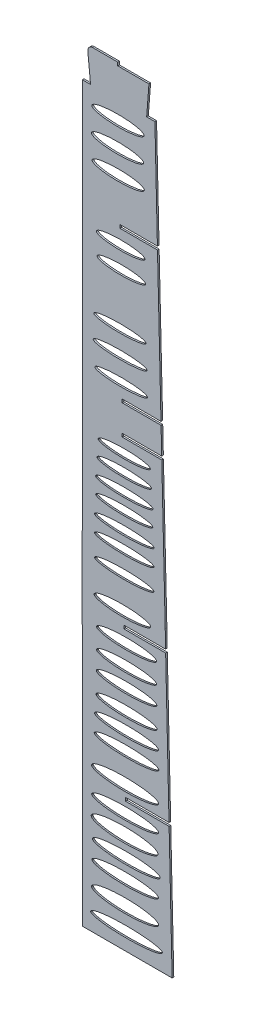
from build123d import *

# Parameters (mm, degrees)
MODEL_RX        = 15.986943764
MODEL_RY        = 2.545009851
MODEL_RX_2      = 16.38041862
MODEL_RX_3      = 15.816069984
MODEL_RX_4      = 14.731308039
MODEL_RY_2      = 2.868687023
MODEL_RX_5      = 15.836678469
MODEL_RY_3      = 3.31867263
EXTRUDE_1_DEPTH = 1


with BuildPart() as part:
    # Model → 凸台-拉伸1 (new body)
    with BuildSketch(Plane.XY):
        with BuildLine():
            Line((944.969286442, 755.114552128), (946.740517092, 678.696633773))
            Line((946.740517092, 678.696633773), (947.021045857, 667.114552128))
            Line((947.021045857, 667.114552128), (920.729970479, 667.114552128))
            Line((920.729970479, 667.114552128), (920.729970479, 665.114552128))
            Line((920.729970479, 665.114552128), (947.067643473, 665.114552128))
            Line((947.067643473, 665.114552128), (948.898027759, 586.364197286))
            Line((948.898027759, 586.364197286), (894.423978417, 586.364197286))
            Line((894.423978417, 586.364197286), (894.423978417, 679.687284047))
            Line((894.423978417, 679.687284047), (894.366320227, 767.566393999))
            Line((894.366320227, 767.566393999), (894.417704122, 858.913946195))
            Line((894.417704122, 858.913946195), (894.417704122, 921.017023249))
            Line((894.417704122, 921.017023249), (894.417704122, 981.017023249))
            Line((894.417704122, 981.017023249), (894.417704122, 1031.017023249))
            Line((894.417704122, 1031.017023249), (899.417704122, 1031.017023249))
            Line((899.417704122, 1031.017023249), (897.747555238, 1047.718512092))
            ThreePointArc((897.747555238, 1047.718512092), (898.508309208, 1050.030039212), (900.732666809, 1051.017023249))
            Line((900.732666809, 1051.017023249), (915.900304122, 1051.017023249))
            Line((915.900304122, 1051.017023249), (915.900304122, 1049.017023249))
            Line((915.900304122, 1049.017023249), (934.837206319, 1049.017023249))
            Line((934.837206319, 1049.017023249), (933.455089527, 1031.017023249))
            Line((933.455089527, 1031.017023249), (938.455089527, 1031.017023249))
            Line((938.455089527, 1031.017023249), (939.615876216, 981.017023249))
            Line((939.615876216, 981.017023249), (939.966332144, 966.352705315))
            Line((939.966332144, 966.352705315), (917.243104122, 966.352705315))
            Line((917.243104122, 966.352705315), (917.243104122, 964.352705315))
            Line((917.243104122, 964.352705315), (940.014130927, 964.352705315))
            Line((940.014130927, 964.352705315), (941.049790049, 921.017023249))
            Line((941.049790049, 921.017023249), (942.140767383, 875.366629343))
            Line((942.140767383, 875.366629343), (918.547704122, 875.366629343))
            Line((918.547704122, 875.366629343), (918.565369917, 873.366629343))
            Line((918.565369917, 873.366629343), (942.188564482, 873.366629343))
            Line((942.188564482, 873.366629343), (942.570941273, 857.364473382))
            Line((942.570941273, 857.364473382), (918.5053725, 857.364473382))
            Line((918.5053725, 857.364473382), (918.517024801, 855.364473382))
            Line((918.517024801, 855.364473382), (942.61634548, 855.364473382))
            Line((942.61634548, 855.364473382), (944.708162801, 767.739836438))
            Line((944.708162801, 767.739836438), (944.90633308, 757.114552128))
            Line((944.90633308, 757.114552128), (919.667487101, 757.114552128))
            Line((919.667487101, 757.114552128), (919.667487101, 755.114552128))
            Line((919.667487101, 755.114552128), (944.969286442, 755.114552128))
        make_face()
        with Locations((917.98787857, 883.919455094)):
            Ellipse(MODEL_RX, MODEL_RY, mode=Mode.SUBTRACT)
        with Locations((917.364059735, 897.974327105)):
            Ellipse(MODEL_RX_2, MODEL_RY, mode=Mode.SUBTRACT)
        with Locations((917.25658158, 911.816381375)):
            Ellipse(MODEL_RX_3, MODEL_RY, mode=Mode.SUBTRACT)
        with Locations((917.707328397, 955.706196734)):
            Ellipse(MODEL_RX_4, MODEL_RY_2, mode=Mode.SUBTRACT)
        with Locations((918.112294937, 942.872396856)):
            Ellipse(MODEL_RX_4, MODEL_RY_2, mode=Mode.SUBTRACT)
        with Locations((916.192845782, 991.771214575)):
            Ellipse(MODEL_RX_5, MODEL_RY_3, mode=Mode.SUBTRACT)
        with Locations((915.810165847, 1005.857350858)):
            Ellipse(MODEL_RX_5, MODEL_RY_3, mode=Mode.SUBTRACT)
        with Locations((916.045975981, 1020.364095818)):
            Ellipse(MODEL_RX_5, MODEL_RY_3, mode=Mode.SUBTRACT)
        Polygon((935.883085878, 764.326737174), (935.863085878, 764.166737174), (935.803085878, 764.006737174), (935.703085878, 763.848737174), (935.553085878, 763.690737174), (935.373085878, 763.533737174), (935.143085878, 763.379737174), (934.883085878, 763.227737174), (934.583085878, 763.077737174), (934.233085878, 762.931737174), (933.863085878, 762.788737174), (933.443085878, 762.648737174), (932.993085878, 762.513737174), (932.513085878, 762.382737174), (931.993085878, 762.256737174), (931.443085878, 762.135737174), (930.863085878, 762.019737174), (930.253085878, 761.908737174), (929.613085878, 761.803737174), (928.953085878, 761.705737174), (928.263085878, 761.613737174), (927.553085878, 761.527737174), (926.813085878, 761.448737174), (926.063085878, 761.376737174), (925.293085878, 761.311737174), (924.513085878, 761.253737174), (923.713085878, 761.203737174), (922.903085878, 761.160737174), (922.083085878, 761.125737174), (921.253085878, 761.098737174), (920.413085878, 761.078737174), (919.573085878, 761.067737174), (918.733085878, 761.063737174), (917.893085878, 761.067737174), (917.053085878, 761.078737174), (916.213085878, 761.098737174), (915.383085878, 761.125737174), (914.563085878, 761.160737174), (913.753085878, 761.203737174), (912.953085878, 761.253737174), (912.173085878, 761.311737174), (911.403085878, 761.376737174), (910.643085878, 761.448737174), (909.913085878, 761.527737174), (909.203085878, 761.613737174), (908.513085878, 761.705737174), (907.853085878, 761.803737174), (907.213085878, 761.908737174), (906.603085878, 762.019737174), (906.023085878, 762.135737174), (905.473085878, 762.256737174), (904.953085878, 762.382737174), (904.473085878, 762.513737174), (904.023085878, 762.648737174), (903.603085878, 762.788737174), (903.233085878, 762.931737174), (902.883085878, 763.077737174), (902.583085878, 763.227737174), (902.323085878, 763.379737174), (902.093085878, 763.533737174), (901.913085878, 763.690737174), (901.763085878, 763.848737174), (901.663085878, 764.006737174), (901.603085878, 764.166737174), (901.583085878, 764.326737174), (901.603085878, 764.487737174), (901.663085878, 764.646737174), (901.763085878, 764.805737174), (901.913085878, 764.963737174), (902.093085878, 765.119737174), (902.323085878, 765.274737174), (902.583085878, 765.426737174), (902.883085878, 765.575737174), (903.233085878, 765.722737174), (903.603085878, 765.865737174), (904.023085878, 766.004737174), (904.473085878, 766.140737174), (904.953085878, 766.271737174), (905.473085878, 766.397737174), (906.023085878, 766.518737174), (906.603085878, 766.634737174), (907.213085878, 766.745737174), (907.853085878, 766.849737174), (908.513085878, 766.948737174), (909.203085878, 767.040737174), (909.913085878, 767.126737174), (910.643085878, 767.205737174), (911.403085878, 767.277737174), (912.173085878, 767.342737174), (912.953085878, 767.399737174), (913.753085878, 767.450737174), (914.563085878, 767.492737174), (915.383085878, 767.527737174), (916.213085878, 767.555737174), (917.053085878, 767.574737174), (917.893085878, 767.586737174), (918.733085878, 767.590737174), (919.573085878, 767.586737174), (920.413085878, 767.574737174), (921.253085878, 767.555737174), (922.083085878, 767.527737174), (922.903085878, 767.492737174), (923.713085878, 767.450737174), (924.513085878, 767.399737174), (925.293085878, 767.342737174), (926.063085878, 767.277737174), (926.813085878, 767.205737174), (927.553085878, 767.126737174), (928.263085878, 767.040737174), (928.953085878, 766.948737174), (929.613085878, 766.849737174), (930.253085878, 766.745737174), (930.863085878, 766.634737174), (931.443085878, 766.518737174), (931.993085878, 766.397737174), (932.513085878, 766.271737174), (932.993085878, 766.140737174), (933.443085878, 766.004737174), (933.863085878, 765.865737174), (934.233085878, 765.722737174), (934.583085878, 765.575737174), (934.883085878, 765.426737174), (935.143085878, 765.274737174), (935.373085878, 765.119737174), (935.553085878, 764.963737174), (935.703085878, 764.805737174), (935.803085878, 764.646737174), (935.863085878, 764.487737174), align=None, mode=Mode.SUBTRACT)
        Polygon((939.473085878, 748.028737174), (939.453085878, 747.867737174), (939.383085878, 747.708737174), (939.273085878, 747.549737174), (939.123085878, 747.391737174), (938.933085878, 747.235737174), (938.693085878, 747.080737174), (938.413085878, 746.928737174), (938.083085878, 746.779737174), (937.723085878, 746.632737174), (937.323085878, 746.489737174), (936.883085878, 746.350737174), (936.403085878, 746.214737174), (935.893085878, 746.083737174), (935.343085878, 745.957737174), (934.753085878, 745.836737174), (934.143085878, 745.720737174), (933.493085878, 745.609737174), (932.813085878, 745.505737174), (932.113085878, 745.406737174), (931.383085878, 745.314737174), (930.623085878, 745.228737174), (929.853085878, 745.149737174), (929.053085878, 745.077737174), (928.233085878, 745.012737174), (927.403085878, 744.955737174), (926.553085878, 744.904737174), (925.693085878, 744.862737174), (924.823085878, 744.826737174), (923.943085878, 744.799737174), (923.053085878, 744.779737174), (922.163085878, 744.768737174), (921.263085878, 744.764737174), (920.373085878, 744.768737174), (919.483085878, 744.779737174), (918.593085878, 744.799737174), (917.713085878, 744.826737174), (916.843085878, 744.862737174), (915.983085878, 744.904737174), (915.133085878, 744.955737174), (914.303085878, 745.012737174), (913.483085878, 745.077737174), (912.683085878, 745.149737174), (911.903085878, 745.228737174), (911.153085878, 745.314737174), (910.423085878, 745.406737174), (909.713085878, 745.505737174), (909.043085878, 745.609737174), (908.393085878, 745.720737174), (907.773085878, 745.836737174), (907.193085878, 745.957737174), (906.643085878, 746.083737174), (906.133085878, 746.214737174), (905.653085878, 746.350737174), (905.213085878, 746.489737174), (904.813085878, 746.632737174), (904.443085878, 746.779737174), (904.123085878, 746.928737174), (903.843085878, 747.080737174), (903.603085878, 747.235737174), (903.413085878, 747.391737174), (903.263085878, 747.549737174), (903.153085878, 747.708737174), (903.083085878, 747.867737174), (903.063085878, 748.028737174), (903.083085878, 748.188737174), (903.153085878, 748.347737174), (903.263085878, 748.506737174), (903.413085878, 748.664737174), (903.603085878, 748.821737174), (903.843085878, 748.975737174), (904.123085878, 749.127737174), (904.443085878, 749.277737174), (904.813085878, 749.423737174), (905.213085878, 749.566737174), (905.653085878, 749.705737174), (906.133085878, 749.841737174), (906.643085878, 749.972737174), (907.193085878, 750.098737174), (907.773085878, 750.219737174), (908.393085878, 750.335737174), (909.043085878, 750.446737174), (909.713085878, 750.550737174), (910.423085878, 750.649737174), (911.153085878, 750.741737174), (911.903085878, 750.827737174), (912.683085878, 750.906737174), (913.483085878, 750.978737174), (914.303085878, 751.043737174), (915.133085878, 751.101737174), (915.983085878, 751.151737174), (916.843085878, 751.194737174), (917.713085878, 751.229737174), (918.593085878, 751.256737174), (919.483085878, 751.276737174), (920.373085878, 751.287737174), (921.263085878, 751.291737174), (922.163085878, 751.287737174), (923.053085878, 751.276737174), (923.943085878, 751.256737174), (924.823085878, 751.229737174), (925.693085878, 751.194737174), (926.553085878, 751.151737174), (927.403085878, 751.101737174), (928.233085878, 751.043737174), (929.053085878, 750.978737174), (929.853085878, 750.906737174), (930.623085878, 750.827737174), (931.383085878, 750.741737174), (932.113085878, 750.649737174), (932.813085878, 750.550737174), (933.493085878, 750.446737174), (934.143085878, 750.335737174), (934.753085878, 750.219737174), (935.343085878, 750.098737174), (935.893085878, 749.972737174), (936.403085878, 749.841737174), (936.883085878, 749.705737174), (937.323085878, 749.566737174), (937.723085878, 749.423737174), (938.083085878, 749.277737174), (938.413085878, 749.127737174), (938.693085878, 748.975737174), (938.933085878, 748.821737174), (939.123085878, 748.664737174), (939.273085878, 748.506737174), (939.383085878, 748.347737174), (939.453085878, 748.188737174), align=None, mode=Mode.SUBTRACT)
        Polygon((939.473085878, 735.969737174), (939.453085878, 735.809737174), (939.383085878, 735.649737174), (939.273085878, 735.491737174), (939.123085878, 735.333737174), (938.933085878, 735.176737174), (938.693085878, 735.022737174), (938.413085878, 734.870737174), (938.083085878, 734.720737174), (937.723085878, 734.574737174), (937.323085878, 734.431737174), (936.883085878, 734.291737174), (936.403085878, 734.156737174), (935.893085878, 734.025737174), (935.343085878, 733.899737174), (934.753085878, 733.778737174), (934.143085878, 733.662737174), (933.493085878, 733.551737174), (932.813085878, 733.446737174), (932.113085878, 733.348737174), (931.383085878, 733.256737174), (930.623085878, 733.170737174), (929.853085878, 733.091737174), (929.053085878, 733.019737174), (928.233085878, 732.954737174), (927.403085878, 732.896737174), (926.553085878, 732.846737174), (925.693085878, 732.803737174), (924.823085878, 732.768737174), (923.943085878, 732.741737174), (923.053085878, 732.721737174), (922.163085878, 732.710737174), (921.263085878, 732.706737174), (920.373085878, 732.710737174), (919.483085878, 732.721737174), (918.593085878, 732.741737174), (917.713085878, 732.768737174), (916.843085878, 732.803737174), (915.983085878, 732.846737174), (915.133085878, 732.896737174), (914.303085878, 732.954737174), (913.483085878, 733.019737174), (912.683085878, 733.091737174), (911.903085878, 733.170737174), (911.153085878, 733.256737174), (910.423085878, 733.348737174), (909.713085878, 733.446737174), (909.043085878, 733.551737174), (908.393085878, 733.662737174), (907.773085878, 733.778737174), (907.193085878, 733.899737174), (906.643085878, 734.025737174), (906.133085878, 734.156737174), (905.653085878, 734.291737174), (905.213085878, 734.431737174), (904.813085878, 734.574737174), (904.443085878, 734.720737174), (904.123085878, 734.870737174), (903.843085878, 735.022737174), (903.603085878, 735.176737174), (903.413085878, 735.333737174), (903.263085878, 735.491737174), (903.153085878, 735.649737174), (903.083085878, 735.809737174), (903.063085878, 735.969737174), (903.083085878, 736.130737174), (903.153085878, 736.289737174), (903.263085878, 736.448737174), (903.413085878, 736.606737174), (903.603085878, 736.762737174), (903.843085878, 736.917737174), (904.123085878, 737.069737174), (904.443085878, 737.218737174), (904.813085878, 737.365737174), (905.213085878, 737.508737174), (905.653085878, 737.647737174), (906.133085878, 737.783737174), (906.643085878, 737.914737174), (907.193085878, 738.040737174), (907.773085878, 738.161737174), (908.393085878, 738.277737174), (909.043085878, 738.388737174), (909.713085878, 738.492737174), (910.423085878, 738.591737174), (911.153085878, 738.683737174), (911.903085878, 738.769737174), (912.683085878, 738.848737174), (913.483085878, 738.920737174), (914.303085878, 738.985737174), (915.133085878, 739.042737174), (915.983085878, 739.093737174), (916.843085878, 739.135737174), (917.713085878, 739.170737174), (918.593085878, 739.198737174), (919.483085878, 739.217737174), (920.373085878, 739.229737174), (921.263085878, 739.233737174), (922.163085878, 739.229737174), (923.053085878, 739.217737174), (923.943085878, 739.198737174), (924.823085878, 739.170737174), (925.693085878, 739.135737174), (926.553085878, 739.093737174), (927.403085878, 739.042737174), (928.233085878, 738.985737174), (929.053085878, 738.920737174), (929.853085878, 738.848737174), (930.623085878, 738.769737174), (931.383085878, 738.683737174), (932.113085878, 738.591737174), (932.813085878, 738.492737174), (933.493085878, 738.388737174), (934.143085878, 738.277737174), (934.753085878, 738.161737174), (935.343085878, 738.040737174), (935.893085878, 737.914737174), (936.403085878, 737.783737174), (936.883085878, 737.647737174), (937.323085878, 737.508737174), (937.723085878, 737.365737174), (938.083085878, 737.218737174), (938.413085878, 737.069737174), (938.693085878, 736.917737174), (938.933085878, 736.762737174), (939.123085878, 736.606737174), (939.273085878, 736.448737174), (939.383085878, 736.289737174), (939.453085878, 736.130737174), align=None, mode=Mode.SUBTRACT)
        Polygon((939.643085878, 724.934737174), (939.623085878, 724.773737174), (939.553085878, 724.614737174), (939.443085878, 724.455737174), (939.283085878, 724.297737174), (939.093085878, 724.141737174), (938.853085878, 723.986737174), (938.563085878, 723.834737174), (938.243085878, 723.685737174), (937.873085878, 723.538737174), (937.473085878, 723.395737174), (937.023085878, 723.256737174), (936.543085878, 723.120737174), (936.023085878, 722.989737174), (935.473085878, 722.863737174), (934.883085878, 722.742737174), (934.263085878, 722.626737174), (933.603085878, 722.515737174), (932.923085878, 722.411737174), (932.213085878, 722.312737174), (931.473085878, 722.220737174), (930.713085878, 722.134737174), (929.933085878, 722.055737174), (929.123085878, 721.983737174), (928.303085878, 721.918737174), (927.453085878, 721.861737174), (926.603085878, 721.810737174), (925.733085878, 721.768737174), (924.853085878, 721.733737174), (923.963085878, 721.705737174), (923.073085878, 721.686737174), (922.173085878, 721.674737174), (921.263085878, 721.670737174), (920.363085878, 721.674737174), (919.463085878, 721.686737174), (918.573085878, 721.705737174), (917.683085878, 721.733737174), (916.803085878, 721.768737174), (915.933085878, 721.810737174), (915.073085878, 721.861737174), (914.233085878, 721.918737174), (913.413085878, 721.983737174), (912.603085878, 722.055737174), (911.823085878, 722.134737174), (911.063085878, 722.220737174), (910.323085878, 722.312737174), (909.613085878, 722.411737174), (908.933085878, 722.515737174), (908.273085878, 722.626737174), (907.653085878, 722.742737174), (907.063085878, 722.863737174), (906.513085878, 722.989737174), (905.993085878, 723.120737174), (905.513085878, 723.256737174), (905.063085878, 723.395737174), (904.663085878, 723.538737174), (904.293085878, 723.685737174), (903.973085878, 723.834737174), (903.683085878, 723.986737174), (903.443085878, 724.141737174), (903.243085878, 724.297737174), (903.093085878, 724.455737174), (902.983085878, 724.614737174), (902.913085878, 724.773737174), (902.893085878, 724.934737174), (902.913085878, 725.094737174), (902.983085878, 725.253737174), (903.093085878, 725.412737174), (903.243085878, 725.570737174), (903.443085878, 725.727737174), (903.683085878, 725.881737174), (903.973085878, 726.033737174), (904.293085878, 726.183737174), (904.663085878, 726.329737174), (905.063085878, 726.472737174), (905.513085878, 726.611737174), (905.993085878, 726.747737174), (906.513085878, 726.878737174), (907.063085878, 727.004737174), (907.653085878, 727.125737174), (908.273085878, 727.241737174), (908.933085878, 727.352737174), (909.613085878, 727.456737174), (910.323085878, 727.555737174), (911.063085878, 727.647737174), (911.823085878, 727.733737174), (912.603085878, 727.812737174), (913.413085878, 727.884737174), (914.233085878, 727.949737174), (915.073085878, 728.007737174), (915.933085878, 728.057737174), (916.803085878, 728.100737174), (917.683085878, 728.135737174), (918.573085878, 728.162737174), (919.463085878, 728.182737174), (920.363085878, 728.193737174), (921.263085878, 728.197737174), (922.173085878, 728.193737174), (923.073085878, 728.182737174), (923.963085878, 728.162737174), (924.853085878, 728.135737174), (925.733085878, 728.100737174), (926.603085878, 728.057737174), (927.453085878, 728.007737174), (928.303085878, 727.949737174), (929.123085878, 727.884737174), (929.933085878, 727.812737174), (930.713085878, 727.733737174), (931.473085878, 727.647737174), (932.213085878, 727.555737174), (932.923085878, 727.456737174), (933.603085878, 727.352737174), (934.263085878, 727.241737174), (934.883085878, 727.125737174), (935.473085878, 727.004737174), (936.023085878, 726.878737174), (936.543085878, 726.747737174), (937.023085878, 726.611737174), (937.473085878, 726.472737174), (937.873085878, 726.329737174), (938.243085878, 726.183737174), (938.563085878, 726.033737174), (938.853085878, 725.881737174), (939.093085878, 725.727737174), (939.283085878, 725.570737174), (939.443085878, 725.412737174), (939.553085878, 725.253737174), (939.623085878, 725.094737174), align=None, mode=Mode.SUBTRACT)
        Polygon((939.803085878, 712.395737174), (939.783085878, 712.235737174), (939.723085878, 712.075737174), (939.603085878, 711.916737174), (939.453085878, 711.758737174), (939.253085878, 711.602737174), (939.013085878, 711.448737174), (938.723085878, 711.295737174), (938.393085878, 711.146737174), (938.023085878, 711.000737174), (937.623085878, 710.856737174), (937.173085878, 710.717737174), (936.683085878, 710.582737174), (936.163085878, 710.451737174), (935.603085878, 710.325737174), (935.003085878, 710.203737174), (934.373085878, 710.087737174), (933.723085878, 709.977737174), (933.033085878, 709.872737174), (932.313085878, 709.774737174), (931.563085878, 709.681737174), (930.803085878, 709.596737174), (930.003085878, 709.517737174), (929.193085878, 709.445737174), (928.363085878, 709.380737174), (927.513085878, 709.322737174), (926.653085878, 709.272737174), (925.773085878, 709.229737174), (924.883085878, 709.194737174), (923.983085878, 709.167737174), (923.083085878, 709.147737174), (922.173085878, 709.135737174), (921.263085878, 709.131737174), (920.353085878, 709.135737174), (919.453085878, 709.147737174), (918.543085878, 709.167737174), (917.653085878, 709.194737174), (916.763085878, 709.229737174), (915.883085878, 709.272737174), (915.023085878, 709.322737174), (914.173085878, 709.380737174), (913.343085878, 709.445737174), (912.523085878, 709.517737174), (911.733085878, 709.596737174), (910.963085878, 709.681737174), (910.223085878, 709.774737174), (909.503085878, 709.872737174), (908.813085878, 709.977737174), (908.153085878, 710.087737174), (907.533085878, 710.203737174), (906.933085878, 710.325737174), (906.373085878, 710.451737174), (905.853085878, 710.582737174), (905.363085878, 710.717737174), (904.913085878, 710.856737174), (904.503085878, 711.000737174), (904.143085878, 711.146737174), (903.813085878, 711.295737174), (903.523085878, 711.448737174), (903.283085878, 711.602737174), (903.083085878, 711.758737174), (902.933085878, 711.916737174), (902.813085878, 712.075737174), (902.753085878, 712.235737174), (902.723085878, 712.395737174), (902.753085878, 712.555737174), (902.813085878, 712.715737174), (902.933085878, 712.874737174), (903.083085878, 713.032737174), (903.283085878, 713.188737174), (903.523085878, 713.342737174), (903.813085878, 713.495737174), (904.143085878, 713.644737174), (904.503085878, 713.790737174), (904.913085878, 713.934737174), (905.363085878, 714.073737174), (905.853085878, 714.208737174), (906.373085878, 714.339737174), (906.933085878, 714.466737174), (907.533085878, 714.587737174), (908.153085878, 714.703737174), (908.813085878, 714.813737174), (909.503085878, 714.918737174), (910.223085878, 715.017737174), (910.963085878, 715.109737174), (911.733085878, 715.194737174), (912.523085878, 715.273737174), (913.343085878, 715.345737174), (914.173085878, 715.410737174), (915.023085878, 715.468737174), (915.883085878, 715.518737174), (916.763085878, 715.561737174), (917.653085878, 715.596737174), (918.543085878, 715.623737174), (919.453085878, 715.643737174), (920.353085878, 715.655737174), (921.263085878, 715.659737174), (922.173085878, 715.655737174), (923.083085878, 715.643737174), (923.983085878, 715.623737174), (924.883085878, 715.596737174), (925.773085878, 715.561737174), (926.653085878, 715.518737174), (927.513085878, 715.468737174), (928.363085878, 715.410737174), (929.193085878, 715.345737174), (930.003085878, 715.273737174), (930.803085878, 715.194737174), (931.563085878, 715.109737174), (932.313085878, 715.017737174), (933.033085878, 714.918737174), (933.723085878, 714.813737174), (934.373085878, 714.703737174), (935.003085878, 714.587737174), (935.603085878, 714.466737174), (936.163085878, 714.339737174), (936.683085878, 714.208737174), (937.173085878, 714.073737174), (937.623085878, 713.934737174), (938.023085878, 713.790737174), (938.393085878, 713.644737174), (938.723085878, 713.495737174), (939.013085878, 713.342737174), (939.253085878, 713.188737174), (939.453085878, 713.032737174), (939.603085878, 712.874737174), (939.723085878, 712.715737174), (939.783085878, 712.555737174), align=None, mode=Mode.SUBTRACT)
        Polygon((940.703085878, 702.070737174), (940.673085878, 701.910737174), (940.603085878, 701.751737174), (940.483085878, 701.592737174), (940.323085878, 701.434737174), (940.113085878, 701.277737174), (939.863085878, 701.123737174), (939.563085878, 700.971737174), (939.223085878, 700.821737174), (938.833085878, 700.675737174), (938.403085878, 700.532737174), (937.933085878, 700.393737174), (937.423085878, 700.257737174), (936.873085878, 700.126737174), (936.283085878, 700.000737174), (935.663085878, 699.879737174), (935.003085878, 699.763737174), (934.313085878, 699.652737174), (933.593085878, 699.548737174), (932.843085878, 699.449737174), (932.063085878, 699.357737174), (931.253085878, 699.271737174), (930.423085878, 699.192737174), (929.573085878, 699.120737174), (928.703085878, 699.055737174), (927.813085878, 698.997737174), (926.903085878, 698.947737174), (925.993085878, 698.905737174), (925.063085878, 698.869737174), (924.123085878, 698.842737174), (923.173085878, 698.822737174), (922.223085878, 698.811737174), (921.263085878, 698.807737174), (920.313085878, 698.811737174), (919.363085878, 698.822737174), (918.413085878, 698.842737174), (917.473085878, 698.869737174), (916.543085878, 698.905737174), (915.623085878, 698.947737174), (914.723085878, 698.997737174), (913.833085878, 699.055737174), (912.963085878, 699.120737174), (912.113085878, 699.192737174), (911.283085878, 699.271737174), (910.473085878, 699.357737174), (909.693085878, 699.449737174), (908.943085878, 699.548737174), (908.223085878, 699.652737174), (907.533085878, 699.763737174), (906.873085878, 699.879737174), (906.243085878, 700.000737174), (905.663085878, 700.126737174), (905.113085878, 700.257737174), (904.603085878, 700.393737174), (904.133085878, 700.532737174), (903.703085878, 700.675737174), (903.313085878, 700.821737174), (902.973085878, 700.971737174), (902.673085878, 701.123737174), (902.423085878, 701.277737174), (902.213085878, 701.434737174), (902.043085878, 701.592737174), (901.933085878, 701.751737174), (901.863085878, 701.910737174), (901.833085878, 702.070737174), (901.863085878, 702.231737174), (901.933085878, 702.390737174), (902.043085878, 702.549737174), (902.213085878, 702.707737174), (902.423085878, 702.863737174), (902.673085878, 703.018737174), (902.973085878, 703.170737174), (903.313085878, 703.319737174), (903.703085878, 703.466737174), (904.133085878, 703.609737174), (904.603085878, 703.748737174), (905.113085878, 703.884737174), (905.663085878, 704.015737174), (906.243085878, 704.141737174), (906.873085878, 704.262737174), (907.533085878, 704.378737174), (908.223085878, 704.489737174), (908.943085878, 704.593737174), (909.693085878, 704.692737174), (910.473085878, 704.784737174), (911.283085878, 704.870737174), (912.113085878, 704.949737174), (912.963085878, 705.021737174), (913.833085878, 705.086737174), (914.723085878, 705.143737174), (915.623085878, 705.194737174), (916.543085878, 705.236737174), (917.473085878, 705.272737174), (918.413085878, 705.299737174), (919.363085878, 705.319737174), (920.313085878, 705.330737174), (921.263085878, 705.334737174), (922.223085878, 705.330737174), (923.173085878, 705.319737174), (924.123085878, 705.299737174), (925.063085878, 705.272737174), (925.993085878, 705.236737174), (926.903085878, 705.194737174), (927.813085878, 705.143737174), (928.703085878, 705.086737174), (929.573085878, 705.021737174), (930.423085878, 704.949737174), (931.253085878, 704.870737174), (932.063085878, 704.784737174), (932.843085878, 704.692737174), (933.593085878, 704.593737174), (934.313085878, 704.489737174), (935.003085878, 704.378737174), (935.663085878, 704.262737174), (936.283085878, 704.141737174), (936.873085878, 704.015737174), (937.423085878, 703.884737174), (937.933085878, 703.748737174), (938.403085878, 703.609737174), (938.833085878, 703.466737174), (939.223085878, 703.319737174), (939.563085878, 703.170737174), (939.863085878, 703.018737174), (940.113085878, 702.863737174), (940.323085878, 702.707737174), (940.483085878, 702.549737174), (940.603085878, 702.390737174), (940.673085878, 702.231737174), align=None, mode=Mode.SUBTRACT)
        Polygon((940.893085878, 691.530737174), (940.873085878, 691.370737174), (940.803085878, 691.210737174), (940.683085878, 691.051737174), (940.523085878, 690.894737174), (940.313085878, 690.737737174), (940.053085878, 690.583737174), (939.753085878, 690.431737174), (939.403085878, 690.281737174), (939.013085878, 690.135737174), (938.583085878, 689.992737174), (938.103085878, 689.852737174), (937.593085878, 689.717737174), (937.033085878, 689.586737174), (936.443085878, 689.460737174), (935.813085878, 689.339737174), (935.143085878, 689.223737174), (934.453085878, 689.112737174), (933.723085878, 689.007737174), (932.963085878, 688.909737174), (932.173085878, 688.817737174), (931.363085878, 688.731737174), (930.523085878, 688.652737174), (929.663085878, 688.580737174), (928.783085878, 688.515737174), (927.883085878, 688.457737174), (926.963085878, 688.407737174), (926.033085878, 688.364737174), (925.093085878, 688.329737174), (924.143085878, 688.302737174), (923.193085878, 688.282737174), (922.233085878, 688.271737174), (921.263085878, 688.267737174), (920.303085878, 688.271737174), (919.343085878, 688.282737174), (918.383085878, 688.302737174), (917.443085878, 688.329737174), (916.503085878, 688.364737174), (915.573085878, 688.407737174), (914.653085878, 688.457737174), (913.753085878, 688.515737174), (912.873085878, 688.580737174), (912.013085878, 688.652737174), (911.173085878, 688.731737174), (910.363085878, 688.817737174), (909.573085878, 688.909737174), (908.813085878, 689.007737174), (908.083085878, 689.112737174), (907.383085878, 689.223737174), (906.723085878, 689.339737174), (906.093085878, 689.460737174), (905.503085878, 689.586737174), (904.943085878, 689.717737174), (904.433085878, 689.852737174), (903.953085878, 689.992737174), (903.523085878, 690.135737174), (903.133085878, 690.281737174), (902.783085878, 690.431737174), (902.483085878, 690.583737174), (902.223085878, 690.737737174), (902.013085878, 690.894737174), (901.853085878, 691.051737174), (901.733085878, 691.210737174), (901.663085878, 691.370737174), (901.643085878, 691.530737174), (901.663085878, 691.690737174), (901.733085878, 691.850737174), (901.853085878, 692.009737174), (902.013085878, 692.167737174), (902.223085878, 692.323737174), (902.483085878, 692.478737174), (902.783085878, 692.630737174), (903.133085878, 692.779737174), (903.523085878, 692.926737174), (903.953085878, 693.069737174), (904.433085878, 693.208737174), (904.943085878, 693.344737174), (905.503085878, 693.475737174), (906.093085878, 693.601737174), (906.723085878, 693.722737174), (907.383085878, 693.838737174), (908.083085878, 693.949737174), (908.813085878, 694.053737174), (909.573085878, 694.152737174), (910.363085878, 694.244737174), (911.173085878, 694.330737174), (912.013085878, 694.409737174), (912.873085878, 694.481737174), (913.753085878, 694.546737174), (914.653085878, 694.603737174), (915.573085878, 694.654737174), (916.503085878, 694.696737174), (917.443085878, 694.731737174), (918.383085878, 694.759737174), (919.343085878, 694.778737174), (920.303085878, 694.790737174), (921.263085878, 694.794737174), (922.233085878, 694.790737174), (923.193085878, 694.778737174), (924.143085878, 694.759737174), (925.093085878, 694.731737174), (926.033085878, 694.696737174), (926.963085878, 694.654737174), (927.883085878, 694.603737174), (928.783085878, 694.546737174), (929.663085878, 694.481737174), (930.523085878, 694.409737174), (931.363085878, 694.330737174), (932.173085878, 694.244737174), (932.963085878, 694.152737174), (933.723085878, 694.053737174), (934.453085878, 693.949737174), (935.143085878, 693.838737174), (935.813085878, 693.722737174), (936.443085878, 693.601737174), (937.033085878, 693.475737174), (937.593085878, 693.344737174), (938.103085878, 693.208737174), (938.583085878, 693.069737174), (939.013085878, 692.926737174), (939.403085878, 692.779737174), (939.753085878, 692.630737174), (940.053085878, 692.478737174), (940.313085878, 692.323737174), (940.523085878, 692.167737174), (940.683085878, 692.009737174), (940.803085878, 691.850737174), (940.873085878, 691.690737174), align=None, mode=Mode.SUBTRACT)
        Polygon((900.011309371, 673.832528614), (900.031309371, 674.019528614), (900.111309371, 674.205528614), (900.231309371, 674.391528614), (900.401309371, 674.575528614), (900.621309371, 674.758528614), (900.891309371, 674.938528614), (901.201309371, 675.116528614), (901.561309371, 675.291528614), (901.961309371, 675.462528614), (902.411309371, 675.629528614), (902.901309371, 675.792528614), (903.441309371, 675.950528614), (904.011309371, 676.103528614), (904.631309371, 676.250528614), (905.281309371, 676.392528614), (905.971309371, 676.528528614), (906.691309371, 676.657528614), (907.451309371, 676.779528614), (908.241309371, 676.894528614), (909.051309371, 677.002528614), (909.901309371, 677.102528614), (910.771309371, 677.194528614), (911.661309371, 677.278528614), (912.571309371, 677.354528614), (913.501309371, 677.421528614), (914.451309371, 677.480528614), (915.411309371, 677.530528614), (916.391309371, 677.571528614), (917.371309371, 677.603528614), (918.361309371, 677.626528614), (919.361309371, 677.640528614), (920.361309371, 677.644528614), (921.361309371, 677.640528614), (922.351309371, 677.626528614), (923.341309371, 677.603528614), (924.331309371, 677.571528614), (925.301309371, 677.530528614), (926.271309371, 677.480528614), (927.211309371, 677.421528614), (928.151309371, 677.354528614), (929.061309371, 677.278528614), (929.951309371, 677.194528614), (930.821309371, 677.102528614), (931.661309371, 677.002528614), (932.481309371, 676.894528614), (933.271309371, 676.779528614), (934.021309371, 676.657528614), (934.751309371, 676.528528614), (935.441309371, 676.392528614), (936.091309371, 676.250528614), (936.701309371, 676.103528614), (937.281309371, 675.950528614), (937.811309371, 675.792528614), (938.301309371, 675.629528614), (938.751309371, 675.462528614), (939.161309371, 675.291528614), (939.521309371, 675.116528614), (939.831309371, 674.938528614), (940.101309371, 674.758528614), (940.321309371, 674.575528614), (940.491309371, 674.391528614), (940.611309371, 674.205528614), (940.681309371, 674.019528614), (940.711309371, 673.832528614), (940.681309371, 673.645528614), (940.611309371, 673.458528614), (940.491309371, 673.272528614), (940.321309371, 673.088528614), (940.101309371, 672.905528614), (939.831309371, 672.725528614), (939.521309371, 672.547528614), (939.161309371, 672.373528614), (938.751309371, 672.201528614), (938.301309371, 672.034528614), (937.811309371, 671.872528614), (937.281309371, 671.713528614), (936.701309371, 671.560528614), (936.091309371, 671.413528614), (935.441309371, 671.271528614), (934.751309371, 671.136528614), (934.021309371, 671.007528614), (933.271309371, 670.884528614), (932.481309371, 670.769528614), (931.661309371, 670.662528614), (930.821309371, 670.561528614), (929.951309371, 670.469528614), (929.061309371, 670.385528614), (928.151309371, 670.309528614), (927.211309371, 670.242528614), (926.271309371, 670.183528614), (925.301309371, 670.133528614), (924.331309371, 670.092528614), (923.341309371, 670.060528614), (922.351309371, 670.037528614), (921.361309371, 670.024528614), (920.361309371, 670.019528614), (919.361309371, 670.024528614), (918.361309371, 670.037528614), (917.371309371, 670.060528614), (916.391309371, 670.092528614), (915.411309371, 670.133528614), (914.451309371, 670.183528614), (913.501309371, 670.242528614), (912.571309371, 670.309528614), (911.661309371, 670.385528614), (910.771309371, 670.469528614), (909.901309371, 670.561528614), (909.051309371, 670.662528614), (908.241309371, 670.769528614), (907.451309371, 670.884528614), (906.691309371, 671.007528614), (905.971309371, 671.136528614), (905.281309371, 671.271528614), (904.631309371, 671.413528614), (904.011309371, 671.560528614), (903.441309371, 671.713528614), (902.901309371, 671.872528614), (902.411309371, 672.034528614), (901.961309371, 672.201528614), (901.561309371, 672.373528614), (901.201309371, 672.547528614), (900.891309371, 672.725528614), (900.621309371, 672.905528614), (900.401309371, 673.088528614), (900.231309371, 673.272528614), (900.111309371, 673.458528614), (900.031309371, 673.645528614), align=None, mode=Mode.SUBTRACT)
        Polygon((900.111309371, 658.612528614), (900.141309371, 658.789528614), (900.211309371, 658.965528614), (900.331309371, 659.141528614), (900.501309371, 659.315528614), (900.721309371, 659.487528614), (900.991309371, 659.658528614), (901.301309371, 659.826528614), (901.661309371, 659.991528614), (902.061309371, 660.153528614), (902.511309371, 660.311528614), (903.001309371, 660.465528614), (903.531309371, 660.614528614), (904.111309371, 660.759528614), (904.721309371, 660.898528614), (905.371309371, 661.032528614), (906.061309371, 661.160528614), (906.781309371, 661.282528614), (907.531309371, 661.398528614), (908.321309371, 661.506528614), (909.131309371, 661.608528614), (909.971309371, 661.703528614), (910.841309371, 661.790528614), (911.731309371, 661.870528614), (912.641309371, 661.941528614), (913.571309371, 662.005528614), (914.521309371, 662.060528614), (915.481309371, 662.108528614), (916.451309371, 662.146528614), (917.431309371, 662.177528614), (918.421309371, 662.198528614), (919.411309371, 662.211528614), (920.411309371, 662.216528614), (921.411309371, 662.211528614), (922.401309371, 662.198528614), (923.391309371, 662.177528614), (924.371309371, 662.146528614), (925.341309371, 662.108528614), (926.301309371, 662.060528614), (927.251309371, 662.005528614), (928.181309371, 661.941528614), (929.091309371, 661.870528614), (929.981309371, 661.790528614), (930.841309371, 661.703528614), (931.691309371, 661.608528614), (932.501309371, 661.506528614), (933.291309371, 661.398528614), (934.041309371, 661.282528614), (934.761309371, 661.160528614), (935.451309371, 661.032528614), (936.101309371, 660.898528614), (936.711309371, 660.759528614), (937.291309371, 660.614528614), (937.821309371, 660.465528614), (938.311309371, 660.311528614), (938.761309371, 660.153528614), (939.161309371, 659.991528614), (939.521309371, 659.826528614), (939.831309371, 659.658528614), (940.101309371, 659.487528614), (940.321309371, 659.315528614), (940.491309371, 659.141528614), (940.611309371, 658.965528614), (940.681309371, 658.789528614), (940.711309371, 658.612528614), (940.681309371, 658.435528614), (940.611309371, 658.259528614), (940.491309371, 658.083528614), (940.321309371, 657.909528614), (940.101309371, 657.736528614), (939.831309371, 657.566528614), (939.521309371, 657.398528614), (939.161309371, 657.233528614), (938.761309371, 657.071528614), (938.311309371, 656.913528614), (937.821309371, 656.759528614), (937.291309371, 656.610528614), (936.711309371, 656.465528614), (936.101309371, 656.326528614), (935.451309371, 656.192528614), (934.761309371, 656.064528614), (934.041309371, 655.942528614), (933.291309371, 655.826528614), (932.501309371, 655.717528614), (931.691309371, 655.615528614), (930.841309371, 655.521528614), (929.981309371, 655.434528614), (929.091309371, 655.354528614), (928.181309371, 655.282528614), (927.251309371, 655.219528614), (926.301309371, 655.163528614), (925.341309371, 655.116528614), (924.371309371, 655.077528614), (923.391309371, 655.047528614), (922.401309371, 655.025528614), (921.411309371, 655.012528614), (920.411309371, 655.008528614), (919.411309371, 655.012528614), (918.421309371, 655.025528614), (917.431309371, 655.047528614), (916.451309371, 655.077528614), (915.481309371, 655.116528614), (914.521309371, 655.163528614), (913.571309371, 655.219528614), (912.641309371, 655.282528614), (911.731309371, 655.354528614), (910.841309371, 655.434528614), (909.971309371, 655.521528614), (909.131309371, 655.615528614), (908.321309371, 655.717528614), (907.531309371, 655.826528614), (906.781309371, 655.942528614), (906.061309371, 656.064528614), (905.371309371, 656.192528614), (904.721309371, 656.326528614), (904.111309371, 656.465528614), (903.531309371, 656.610528614), (903.001309371, 656.759528614), (902.511309371, 656.913528614), (902.061309371, 657.071528614), (901.661309371, 657.233528614), (901.301309371, 657.398528614), (900.991309371, 657.566528614), (900.721309371, 657.736528614), (900.501309371, 657.909528614), (900.331309371, 658.083528614), (900.211309371, 658.259528614), (900.141309371, 658.435528614), align=None, mode=Mode.SUBTRACT)
        Polygon((899.781309371, 647.127528614), (899.811309371, 647.342528614), (899.881309371, 647.556528614), (900.001309371, 647.768528614), (900.171309371, 647.980528614), (900.391309371, 648.189528614), (900.661309371, 648.396528614), (900.971309371, 648.599528614), (901.331309371, 648.799528614), (901.731309371, 648.995528614), (902.181309371, 649.187528614), (902.671309371, 649.373528614), (903.201309371, 649.554528614), (903.781309371, 649.730528614), (904.391309371, 649.899528614), (905.041309371, 650.061528614), (905.731309371, 650.216528614), (906.451309371, 650.364528614), (907.201309371, 650.504528614), (907.991309371, 650.636528614), (908.801309371, 650.760528614), (909.651309371, 650.874528614), (910.511309371, 650.980528614), (911.401309371, 651.076528614), (912.311309371, 651.163528614), (913.241309371, 651.240528614), (914.191309371, 651.308528614), (915.151309371, 651.365528614), (916.121309371, 651.412528614), (917.101309371, 651.449528614), (918.091309371, 651.475528614), (919.081309371, 651.491528614), (920.081309371, 651.496528614), (921.081309371, 651.491528614), (922.071309371, 651.475528614), (923.061309371, 651.449528614), (924.041309371, 651.412528614), (925.011309371, 651.365528614), (925.971309371, 651.308528614), (926.921309371, 651.240528614), (927.851309371, 651.163528614), (928.761309371, 651.076528614), (929.651309371, 650.980528614), (930.521309371, 650.874528614), (931.361309371, 650.760528614), (932.171309371, 650.636528614), (932.961309371, 650.504528614), (933.711309371, 650.364528614), (934.431309371, 650.216528614), (935.121309371, 650.061528614), (935.771309371, 649.899528614), (936.381309371, 649.730528614), (936.961309371, 649.554528614), (937.491309371, 649.373528614), (937.981309371, 649.187528614), (938.431309371, 648.995528614), (938.831309371, 648.799528614), (939.191309371, 648.599528614), (939.501309371, 648.396528614), (939.771309371, 648.189528614), (939.991309371, 647.980528614), (940.161309371, 647.768528614), (940.281309371, 647.556528614), (940.351309371, 647.342528614), (940.381309371, 647.127528614), (940.351309371, 646.913528614), (940.281309371, 646.699528614), (940.161309371, 646.487528614), (939.991309371, 646.275528614), (939.771309371, 646.066528614), (939.501309371, 645.859528614), (939.191309371, 645.656528614), (938.831309371, 645.456528614), (938.431309371, 645.260528614), (937.981309371, 645.068528614), (937.491309371, 644.882528614), (936.961309371, 644.701528614), (936.381309371, 644.525528614), (935.771309371, 644.356528614), (935.121309371, 644.194528614), (934.431309371, 644.039528614), (933.711309371, 643.891528614), (932.961309371, 643.751528614), (932.171309371, 643.619528614), (931.361309371, 643.495528614), (930.521309371, 643.381528614), (929.651309371, 643.275528614), (928.761309371, 643.179528614), (927.851309371, 643.092528614), (926.921309371, 643.015528614), (925.971309371, 642.947528614), (925.011309371, 642.890528614), (924.041309371, 642.843528614), (923.061309371, 642.806528614), (922.071309371, 642.780528614), (921.081309371, 642.764528614), (920.081309371, 642.759528614), (919.081309371, 642.764528614), (918.091309371, 642.780528614), (917.101309371, 642.806528614), (916.121309371, 642.843528614), (915.151309371, 642.890528614), (914.191309371, 642.947528614), (913.241309371, 643.015528614), (912.311309371, 643.092528614), (911.401309371, 643.179528614), (910.511309371, 643.275528614), (909.651309371, 643.381528614), (908.801309371, 643.495528614), (907.991309371, 643.619528614), (907.201309371, 643.751528614), (906.451309371, 643.891528614), (905.731309371, 644.039528614), (905.041309371, 644.194528614), (904.391309371, 644.356528614), (903.781309371, 644.525528614), (903.201309371, 644.701528614), (902.671309371, 644.882528614), (902.181309371, 645.068528614), (901.731309371, 645.260528614), (901.331309371, 645.456528614), (900.971309371, 645.656528614), (900.661309371, 645.859528614), (900.391309371, 646.066528614), (900.171309371, 646.275528614), (900.001309371, 646.487528614), (899.881309371, 646.699528614), (899.811309371, 646.913528614), align=None, mode=Mode.SUBTRACT)
        Polygon((900.481309371, 635.399528614), (900.511309371, 635.570528614), (900.581309371, 635.741528614), (900.701309371, 635.912528614), (900.881309371, 636.081528614), (901.101309371, 636.248528614), (901.371309371, 636.413528614), (901.691309371, 636.576528614), (902.051309371, 636.736528614), (902.461309371, 636.893528614), (902.911309371, 637.046528614), (903.411309371, 637.195528614), (903.951309371, 637.340528614), (904.541309371, 637.480528614), (905.161309371, 637.616528614), (905.821309371, 637.746528614), (906.521309371, 637.870528614), (907.251309371, 637.988528614), (908.011309371, 638.100528614), (908.811309371, 638.206528614), (909.641309371, 638.304528614), (910.491309371, 638.396528614), (911.371309371, 638.481528614), (912.281309371, 638.558528614), (913.201309371, 638.627528614), (914.141309371, 638.689528614), (915.101309371, 638.743528614), (916.081309371, 638.789528614), (917.061309371, 638.826528614), (918.061309371, 638.855528614), (919.061309371, 638.876528614), (920.071309371, 638.889528614), (921.081309371, 638.893528614), (922.101309371, 638.889528614), (923.101309371, 638.876528614), (924.111309371, 638.855528614), (925.101309371, 638.826528614), (926.091309371, 638.789528614), (927.061309371, 638.743528614), (928.031309371, 638.689528614), (928.971309371, 638.627528614), (929.891309371, 638.558528614), (930.801309371, 638.481528614), (931.681309371, 638.396528614), (932.531309371, 638.304528614), (933.361309371, 638.206528614), (934.151309371, 638.100528614), (934.921309371, 637.988528614), (935.651309371, 637.870528614), (936.351309371, 637.746528614), (937.011309371, 637.616528614), (937.631309371, 637.480528614), (938.211309371, 637.340528614), (938.761309371, 637.195528614), (939.251309371, 637.046528614), (939.711309371, 636.893528614), (940.121309371, 636.736528614), (940.481309371, 636.576528614), (940.801309371, 636.413528614), (941.071309371, 636.248528614), (941.291309371, 636.081528614), (941.461309371, 635.912528614), (941.591309371, 635.741528614), (941.661309371, 635.570528614), (941.691309371, 635.399528614), (941.661309371, 635.227528614), (941.591309371, 635.056528614), (941.461309371, 634.886528614), (941.291309371, 634.717528614), (941.071309371, 634.550528614), (940.801309371, 634.384528614), (940.481309371, 634.221528614), (940.121309371, 634.061528614), (939.711309371, 633.905528614), (939.251309371, 633.751528614), (938.761309371, 633.602528614), (938.211309371, 633.457528614), (937.631309371, 633.317528614), (937.011309371, 633.182528614), (936.351309371, 633.052528614), (935.651309371, 632.928528614), (934.921309371, 632.809528614), (934.151309371, 632.697528614), (933.361309371, 632.592528614), (932.531309371, 632.493528614), (931.681309371, 632.401528614), (930.801309371, 632.317528614), (929.891309371, 632.240528614), (928.971309371, 632.170528614), (928.031309371, 632.109528614), (927.061309371, 632.055528614), (926.091309371, 632.009528614), (925.101309371, 631.971528614), (924.111309371, 631.942528614), (923.101309371, 631.921528614), (922.101309371, 631.908528614), (921.081309371, 631.904528614), (920.071309371, 631.908528614), (919.061309371, 631.921528614), (918.061309371, 631.942528614), (917.061309371, 631.971528614), (916.081309371, 632.009528614), (915.101309371, 632.055528614), (914.141309371, 632.109528614), (913.201309371, 632.170528614), (912.281309371, 632.240528614), (911.371309371, 632.317528614), (910.491309371, 632.401528614), (909.641309371, 632.493528614), (908.811309371, 632.592528614), (908.011309371, 632.697528614), (907.251309371, 632.809528614), (906.521309371, 632.928528614), (905.821309371, 633.052528614), (905.161309371, 633.182528614), (904.541309371, 633.317528614), (903.951309371, 633.457528614), (903.411309371, 633.602528614), (902.911309371, 633.751528614), (902.461309371, 633.905528614), (902.051309371, 634.061528614), (901.691309371, 634.221528614), (901.371309371, 634.384528614), (901.101309371, 634.550528614), (900.881309371, 634.717528614), (900.701309371, 634.886528614), (900.581309371, 635.056528614), (900.511309371, 635.227528614), align=None, mode=Mode.SUBTRACT)
        Polygon((900.231309371, 624.307528614), (900.261309371, 624.482528614), (900.331309371, 624.656528614), (900.451309371, 624.830528614), (900.621309371, 625.002528614), (900.841309371, 625.173528614), (901.101309371, 625.342528614), (901.411309371, 625.508528614), (901.771309371, 625.671528614), (902.171309371, 625.831528614), (902.621309371, 625.988528614), (903.111309371, 626.140528614), (903.641309371, 626.288528614), (904.211309371, 626.431528614), (904.821309371, 626.569528614), (905.461309371, 626.701528614), (906.151309371, 626.828528614), (906.871309371, 626.949528614), (907.621309371, 627.063528614), (908.401309371, 627.171528614), (909.211309371, 627.272528614), (910.041309371, 627.365528614), (910.911309371, 627.451528614), (911.791309371, 627.530528614), (912.701309371, 627.601528614), (913.621309371, 627.664528614), (914.561309371, 627.719528614), (915.521309371, 627.766528614), (916.491309371, 627.804528614), (917.461309371, 627.834528614), (918.451309371, 627.855528614), (919.431309371, 627.868528614), (920.421309371, 627.872528614), (921.411309371, 627.868528614), (922.401309371, 627.855528614), (923.391309371, 627.834528614), (924.361309371, 627.804528614), (925.331309371, 627.766528614), (926.281309371, 627.719528614), (927.231309371, 627.664528614), (928.151309371, 627.601528614), (929.061309371, 627.530528614), (929.941309371, 627.451528614), (930.801309371, 627.365528614), (931.641309371, 627.272528614), (932.451309371, 627.171528614), (933.231309371, 627.063528614), (933.981309371, 626.949528614), (934.701309371, 626.828528614), (935.381309371, 626.701528614), (936.031309371, 626.569528614), (936.641309371, 626.431528614), (937.211309371, 626.288528614), (937.741309371, 626.140528614), (938.231309371, 625.988528614), (938.681309371, 625.831528614), (939.081309371, 625.671528614), (939.431309371, 625.508528614), (939.741309371, 625.342528614), (940.011309371, 625.173528614), (940.231309371, 625.002528614), (940.401309371, 624.830528614), (940.521309371, 624.656528614), (940.591309371, 624.482528614), (940.611309371, 624.307528614), (940.591309371, 624.132528614), (940.521309371, 623.957528614), (940.401309371, 623.784528614), (940.231309371, 623.611528614), (940.011309371, 623.440528614), (939.741309371, 623.272528614), (939.431309371, 623.105528614), (939.081309371, 622.942528614), (938.681309371, 622.782528614), (938.231309371, 622.626528614), (937.741309371, 622.474528614), (937.211309371, 622.326528614), (936.641309371, 622.183528614), (936.031309371, 622.045528614), (935.381309371, 621.912528614), (934.701309371, 621.785528614), (933.981309371, 621.665528614), (933.231309371, 621.550528614), (932.451309371, 621.443528614), (931.641309371, 621.342528614), (930.801309371, 621.248528614), (929.941309371, 621.162528614), (929.061309371, 621.083528614), (928.151309371, 621.012528614), (927.231309371, 620.949528614), (926.281309371, 620.895528614), (925.331309371, 620.848528614), (924.361309371, 620.809528614), (923.391309371, 620.780528614), (922.401309371, 620.758528614), (921.411309371, 620.745528614), (920.421309371, 620.741528614), (919.431309371, 620.745528614), (918.451309371, 620.758528614), (917.461309371, 620.780528614), (916.491309371, 620.809528614), (915.521309371, 620.848528614), (914.561309371, 620.895528614), (913.621309371, 620.949528614), (912.701309371, 621.012528614), (911.791309371, 621.083528614), (910.911309371, 621.162528614), (910.041309371, 621.248528614), (909.211309371, 621.342528614), (908.401309371, 621.443528614), (907.621309371, 621.550528614), (906.871309371, 621.665528614), (906.151309371, 621.785528614), (905.461309371, 621.912528614), (904.821309371, 622.045528614), (904.211309371, 622.183528614), (903.641309371, 622.326528614), (903.111309371, 622.474528614), (902.621309371, 622.626528614), (902.171309371, 622.782528614), (901.771309371, 622.942528614), (901.411309371, 623.105528614), (901.101309371, 623.272528614), (900.841309371, 623.440528614), (900.621309371, 623.611528614), (900.451309371, 623.784528614), (900.331309371, 623.957528614), (900.261309371, 624.132528614), align=None, mode=Mode.SUBTRACT)
        Polygon((900.001309371, 610.074528614), (900.031309371, 610.277528614), (900.101309371, 610.479528614), (900.221309371, 610.681528614), (900.401309371, 610.881528614), (900.611309371, 611.079528614), (900.881309371, 611.275528614), (901.191309371, 611.468528614), (901.551309371, 611.658528614), (901.961309371, 611.843528614), (902.411309371, 612.025528614), (902.901309371, 612.201528614), (903.441309371, 612.373528614), (904.011309371, 612.539528614), (904.631309371, 612.699528614), (905.281309371, 612.853528614), (905.971309371, 613.000528614), (906.691309371, 613.140528614), (907.451309371, 613.273528614), (908.241309371, 613.398528614), (909.051309371, 613.515528614), (909.901309371, 613.623528614), (910.771309371, 613.723528614), (911.661309371, 613.815528614), (912.571309371, 613.897528614), (913.501309371, 613.970528614), (914.451309371, 614.034528614), (915.421309371, 614.088528614), (916.391309371, 614.133528614), (917.381309371, 614.167528614), (918.371309371, 614.192528614), (919.361309371, 614.207528614), (920.361309371, 614.212528614), (921.361309371, 614.207528614), (922.361309371, 614.192528614), (923.351309371, 614.167528614), (924.331309371, 614.133528614), (925.311309371, 614.088528614), (926.271309371, 614.034528614), (927.221309371, 613.970528614), (928.151309371, 613.897528614), (929.071309371, 613.815528614), (929.961309371, 613.723528614), (930.831309371, 613.623528614), (931.671309371, 613.515528614), (932.491309371, 613.398528614), (933.281309371, 613.273528614), (934.031309371, 613.140528614), (934.761309371, 613.000528614), (935.451309371, 612.853528614), (936.101309371, 612.699528614), (936.711309371, 612.539528614), (937.291309371, 612.373528614), (937.821309371, 612.201528614), (938.321309371, 612.025528614), (938.771309371, 611.843528614), (939.171309371, 611.658528614), (939.531309371, 611.468528614), (939.841309371, 611.275528614), (940.111309371, 611.079528614), (940.331309371, 610.881528614), (940.501309371, 610.681528614), (940.621309371, 610.479528614), (940.701309371, 610.277528614), (940.721309371, 610.074528614), (940.701309371, 609.871528614), (940.621309371, 609.668528614), (940.501309371, 609.467528614), (940.331309371, 609.267528614), (940.111309371, 609.068528614), (939.841309371, 608.873528614), (939.531309371, 608.680528614), (939.171309371, 608.490528614), (938.771309371, 608.305528614), (938.321309371, 608.123528614), (937.821309371, 607.946528614), (937.291309371, 607.775528614), (936.711309371, 607.609528614), (936.101309371, 607.449528614), (935.451309371, 607.295528614), (934.761309371, 607.148528614), (934.031309371, 607.008528614), (933.281309371, 606.875528614), (932.491309371, 606.750528614), (931.671309371, 606.633528614), (930.831309371, 606.524528614), (929.961309371, 606.424528614), (929.071309371, 606.333528614), (928.151309371, 606.251528614), (927.221309371, 606.178528614), (926.271309371, 606.114528614), (925.311309371, 606.060528614), (924.331309371, 606.015528614), (923.351309371, 605.980528614), (922.361309371, 605.956528614), (921.361309371, 605.941528614), (920.361309371, 605.936528614), (919.361309371, 605.941528614), (918.371309371, 605.956528614), (917.381309371, 605.980528614), (916.391309371, 606.015528614), (915.421309371, 606.060528614), (914.451309371, 606.114528614), (913.501309371, 606.178528614), (912.571309371, 606.251528614), (911.661309371, 606.333528614), (910.771309371, 606.424528614), (909.901309371, 606.524528614), (909.051309371, 606.633528614), (908.241309371, 606.750528614), (907.451309371, 606.875528614), (906.691309371, 607.008528614), (905.971309371, 607.148528614), (905.281309371, 607.295528614), (904.631309371, 607.449528614), (904.011309371, 607.609528614), (903.441309371, 607.775528614), (902.901309371, 607.946528614), (902.411309371, 608.123528614), (901.961309371, 608.305528614), (901.551309371, 608.490528614), (901.191309371, 608.680528614), (900.881309371, 608.873528614), (900.611309371, 609.068528614), (900.401309371, 609.267528614), (900.221309371, 609.467528614), (900.101309371, 609.668528614), (900.031309371, 609.871528614), align=None, mode=Mode.SUBTRACT)
        Polygon((899.431309371, 596.671528614), (899.451309371, 596.830528614), (899.531309371, 596.988528614), (899.661309371, 597.145528614), (899.851309371, 597.301528614), (900.081309371, 597.456528614), (900.371309371, 597.609528614), (900.701309371, 597.759528614), (901.091309371, 597.907528614), (901.521309371, 598.052528614), (902.001309371, 598.194528614), (902.531309371, 598.331528614), (903.101309371, 598.465528614), (903.711309371, 598.595528614), (904.371309371, 598.720528614), (905.071309371, 598.840528614), (905.811309371, 598.955528614), (906.581309371, 599.064528614), (907.391309371, 599.168528614), (908.231309371, 599.265528614), (909.111309371, 599.356528614), (910.011309371, 599.441528614), (910.941309371, 599.519528614), (911.901309371, 599.591528614), (912.871309371, 599.655528614), (913.871309371, 599.712528614), (914.891309371, 599.762528614), (915.921309371, 599.804528614), (916.961309371, 599.839528614), (918.011309371, 599.866528614), (919.071309371, 599.885528614), (920.141309371, 599.897528614), (921.211309371, 599.901528614), (922.281309371, 599.897528614), (923.341309371, 599.885528614), (924.401309371, 599.866528614), (925.461309371, 599.839528614), (926.501309371, 599.804528614), (927.531309371, 599.762528614), (928.551309371, 599.712528614), (929.541309371, 599.655528614), (930.521309371, 599.591528614), (931.471309371, 599.519528614), (932.411309371, 599.441528614), (933.311309371, 599.356528614), (934.181309371, 599.265528614), (935.021309371, 599.168528614), (935.831309371, 599.064528614), (936.611309371, 598.955528614), (937.351309371, 598.840528614), (938.041309371, 598.720528614), (938.701309371, 598.595528614), (939.321309371, 598.465528614), (939.891309371, 598.331528614), (940.421309371, 598.194528614), (940.901309371, 598.052528614), (941.331309371, 597.907528614), (941.711309371, 597.759528614), (942.051309371, 597.609528614), (942.341309371, 597.456528614), (942.571309371, 597.301528614), (942.751309371, 597.145528614), (942.881309371, 596.988528614), (942.961309371, 596.830528614), (942.991309371, 596.671528614), (942.961309371, 596.513528614), (942.881309371, 596.355528614), (942.751309371, 596.197528614), (942.571309371, 596.041528614), (942.341309371, 595.886528614), (942.051309371, 595.734528614), (941.711309371, 595.583528614), (941.331309371, 595.435528614), (940.901309371, 595.290528614), (940.421309371, 595.149528614), (939.891309371, 595.011528614), (939.321309371, 594.877528614), (938.701309371, 594.747528614), (938.041309371, 594.622528614), (937.351309371, 594.502528614), (936.611309371, 594.387528614), (935.831309371, 594.278528614), (935.021309371, 594.175528614), (934.181309371, 594.077528614), (933.311309371, 593.986528614), (932.411309371, 593.901528614), (931.471309371, 593.823528614), (930.521309371, 593.752528614), (929.541309371, 593.687528614), (928.551309371, 593.630528614), (927.531309371, 593.581528614), (926.501309371, 593.538528614), (925.461309371, 593.503528614), (924.401309371, 593.476528614), (923.341309371, 593.457528614), (922.281309371, 593.445528614), (921.211309371, 593.441528614), (920.141309371, 593.445528614), (919.071309371, 593.457528614), (918.011309371, 593.476528614), (916.961309371, 593.503528614), (915.921309371, 593.538528614), (914.891309371, 593.581528614), (913.871309371, 593.630528614), (912.871309371, 593.687528614), (911.901309371, 593.752528614), (910.941309371, 593.823528614), (910.011309371, 593.901528614), (909.111309371, 593.986528614), (908.231309371, 594.077528614), (907.391309371, 594.175528614), (906.581309371, 594.278528614), (905.811309371, 594.387528614), (905.071309371, 594.502528614), (904.371309371, 594.622528614), (903.711309371, 594.747528614), (903.101309371, 594.877528614), (902.531309371, 595.011528614), (902.001309371, 595.149528614), (901.521309371, 595.290528614), (901.091309371, 595.435528614), (900.701309371, 595.583528614), (900.371309371, 595.734528614), (900.081309371, 595.886528614), (899.851309371, 596.041528614), (899.661309371, 596.197528614), (899.531309371, 596.355528614), (899.451309371, 596.513528614), align=None, mode=Mode.SUBTRACT)
        Polygon((904.029257883, 847.195168717), (904.049257883, 847.328168717), (904.099257883, 847.460168717), (904.199257883, 847.591168717), (904.329257883, 847.722168717), (904.499257883, 847.851168717), (904.709257883, 847.979168717), (904.949257883, 848.105168717), (905.229257883, 848.228168717), (905.549257883, 848.350168717), (905.899257883, 848.468168717), (906.279257883, 848.583168717), (906.699257883, 848.695168717), (907.149257883, 848.804168717), (907.619257883, 848.908168717), (908.129257883, 849.008168717), (908.669257883, 849.104168717), (909.229257883, 849.196168717), (909.819257883, 849.282168717), (910.429257883, 849.364168717), (911.069257883, 849.440168717), (911.729257883, 849.511168717), (912.399257883, 849.576168717), (913.099257883, 849.636168717), (913.809257883, 849.689168717), (914.529257883, 849.737168717), (915.269257883, 849.779168717), (916.019257883, 849.814168717), (916.779257883, 849.843168717), (917.539257883, 849.866168717), (918.319257883, 849.882168717), (919.089257883, 849.892168717), (919.869257883, 849.895168717), (920.649257883, 849.892168717), (921.419257883, 849.882168717), (922.189257883, 849.866168717), (922.959257883, 849.843168717), (923.719257883, 849.814168717), (924.469257883, 849.779168717), (925.209257883, 849.737168717), (925.929257883, 849.689168717), (926.639257883, 849.636168717), (927.339257883, 849.576168717), (928.009257883, 849.511168717), (928.669257883, 849.440168717), (929.299257883, 849.364168717), (929.919257883, 849.282168717), (930.509257883, 849.196168717), (931.069257883, 849.104168717), (931.609257883, 849.008168717), (932.109257883, 848.908168717), (932.589257883, 848.804168717), (933.039257883, 848.695168717), (933.459257883, 848.583168717), (933.839257883, 848.468168717), (934.189257883, 848.350168717), (934.499257883, 848.228168717), (934.779257883, 848.105168717), (935.029257883, 847.979168717), (935.229257883, 847.851168717), (935.399257883, 847.722168717), (935.539257883, 847.591168717), (935.629257883, 847.460168717), (935.689257883, 847.328168717), (935.709257883, 847.195168717), (935.689257883, 847.063168717), (935.629257883, 846.931168717), (935.539257883, 846.799168717), (935.399257883, 846.669168717), (935.229257883, 846.539168717), (935.029257883, 846.412168717), (934.779257883, 846.286168717), (934.499257883, 846.162168717), (934.189257883, 846.041168717), (933.839257883, 845.923168717), (933.459257883, 845.807168717), (933.039257883, 845.696168717), (932.589257883, 845.587168717), (932.109257883, 845.483168717), (931.609257883, 845.382168717), (931.069257883, 845.286168717), (930.509257883, 845.195168717), (929.919257883, 845.109168717), (929.299257883, 845.027168717), (928.669257883, 844.951168717), (928.009257883, 844.880168717), (927.339257883, 844.815168717), (926.639257883, 844.755168717), (925.929257883, 844.701168717), (925.209257883, 844.654168717), (924.469257883, 844.612168717), (923.719257883, 844.577168717), (922.959257883, 844.548168717), (922.189257883, 844.525168717), (921.419257883, 844.509168717), (920.649257883, 844.499168717), (919.869257883, 844.496168717), (919.089257883, 844.499168717), (918.319257883, 844.509168717), (917.539257883, 844.525168717), (916.779257883, 844.548168717), (916.019257883, 844.577168717), (915.269257883, 844.612168717), (914.529257883, 844.654168717), (913.809257883, 844.701168717), (913.099257883, 844.755168717), (912.399257883, 844.815168717), (911.729257883, 844.880168717), (911.069257883, 844.951168717), (910.429257883, 845.027168717), (909.819257883, 845.109168717), (909.229257883, 845.195168717), (908.669257883, 845.286168717), (908.129257883, 845.382168717), (907.619257883, 845.483168717), (907.149257883, 845.587168717), (906.699257883, 845.696168717), (906.279257883, 845.807168717), (905.899257883, 845.923168717), (905.549257883, 846.041168717), (905.229257883, 846.162168717), (904.949257883, 846.286168717), (904.709257883, 846.412168717), (904.499257883, 846.539168717), (904.329257883, 846.669168717), (904.199257883, 846.799168717), (904.099257883, 846.931168717), (904.049257883, 847.063168717), align=None, mode=Mode.SUBTRACT)
        Polygon((903.329257883, 837.242168717), (903.339257883, 837.374168717), (903.399257883, 837.506168717), (903.499257883, 837.638168717), (903.639257883, 837.768168717), (903.819257883, 837.898168717), (904.039257883, 838.025168717), (904.289257883, 838.151168717), (904.579257883, 838.275168717), (904.909257883, 838.396168717), (905.279257883, 838.514168717), (905.679257883, 838.630168717), (906.109257883, 838.742168717), (906.579257883, 838.850168717), (907.079257883, 838.954168717), (907.609257883, 839.055168717), (908.169257883, 839.151168717), (908.759257883, 839.242168717), (909.369257883, 839.329168717), (910.009257883, 839.410168717), (910.679257883, 839.486168717), (911.359257883, 839.557168717), (912.069257883, 839.623168717), (912.799257883, 839.682168717), (913.539257883, 839.736168717), (914.299257883, 839.784168717), (915.069257883, 839.825168717), (915.849257883, 839.860168717), (916.639257883, 839.889168717), (917.439257883, 839.912168717), (918.249257883, 839.928168717), (919.059257883, 839.938168717), (919.869257883, 839.941168717), (920.679257883, 839.938168717), (921.489257883, 839.928168717), (922.299257883, 839.912168717), (923.099257883, 839.889168717), (923.889257883, 839.860168717), (924.669257883, 839.825168717), (925.439257883, 839.784168717), (926.199257883, 839.736168717), (926.939257883, 839.682168717), (927.669257883, 839.623168717), (928.369257883, 839.557168717), (929.059257883, 839.486168717), (929.719257883, 839.410168717), (930.359257883, 839.329168717), (930.979257883, 839.242168717), (931.569257883, 839.151168717), (932.129257883, 839.055168717), (932.659257883, 838.954168717), (933.159257883, 838.850168717), (933.619257883, 838.742168717), (934.059257883, 838.630168717), (934.459257883, 838.514168717), (934.819257883, 838.396168717), (935.149257883, 838.275168717), (935.449257883, 838.151168717), (935.699257883, 838.025168717), (935.919257883, 837.898168717), (936.089257883, 837.768168717), (936.229257883, 837.638168717), (936.329257883, 837.506168717), (936.389257883, 837.374168717), (936.409257883, 837.242168717), (936.389257883, 837.109168717), (936.329257883, 836.977168717), (936.229257883, 836.846168717), (936.089257883, 836.715168717), (935.919257883, 836.586168717), (935.699257883, 836.458168717), (935.449257883, 836.332168717), (935.149257883, 836.209168717), (934.819257883, 836.087168717), (934.459257883, 835.969168717), (934.059257883, 835.854168717), (933.619257883, 835.742168717), (933.159257883, 835.634168717), (932.659257883, 835.529168717), (932.129257883, 835.429168717), (931.569257883, 835.333168717), (930.979257883, 835.241168717), (930.359257883, 835.155168717), (929.719257883, 835.073168717), (929.059257883, 834.997168717), (928.369257883, 834.926168717), (927.669257883, 834.861168717), (926.939257883, 834.801168717), (926.199257883, 834.748168717), (925.439257883, 834.700168717), (924.669257883, 834.658168717), (923.889257883, 834.623168717), (923.099257883, 834.594168717), (922.299257883, 834.571168717), (921.489257883, 834.555168717), (920.679257883, 834.545168717), (919.869257883, 834.542168717), (919.059257883, 834.545168717), (918.249257883, 834.555168717), (917.439257883, 834.571168717), (916.639257883, 834.594168717), (915.849257883, 834.623168717), (915.069257883, 834.658168717), (914.299257883, 834.700168717), (913.539257883, 834.748168717), (912.799257883, 834.801168717), (912.069257883, 834.861168717), (911.359257883, 834.926168717), (910.679257883, 834.997168717), (910.009257883, 835.073168717), (909.369257883, 835.155168717), (908.759257883, 835.241168717), (908.169257883, 835.333168717), (907.609257883, 835.429168717), (907.079257883, 835.529168717), (906.579257883, 835.634168717), (906.109257883, 835.742168717), (905.679257883, 835.854168717), (905.279257883, 835.969168717), (904.909257883, 836.087168717), (904.579257883, 836.209168717), (904.289257883, 836.332168717), (904.039257883, 836.458168717), (903.819257883, 836.586168717), (903.639257883, 836.715168717), (903.499257883, 836.846168717), (903.399257883, 836.977168717), (903.339257883, 837.109168717), align=None, mode=Mode.SUBTRACT)
        Polygon((902.409257883, 826.905168717), (902.429257883, 827.038168717), (902.489257883, 827.170168717), (902.599257883, 827.302168717), (902.749257883, 827.432168717), (902.929257883, 827.561168717), (903.159257883, 827.689168717), (903.429257883, 827.815168717), (903.739257883, 827.938168717), (904.089257883, 828.060168717), (904.469257883, 828.178168717), (904.889257883, 828.293168717), (905.349257883, 828.405168717), (905.849257883, 828.514168717), (906.369257883, 828.618168717), (906.929257883, 828.718168717), (907.519257883, 828.814168717), (908.139257883, 828.906168717), (908.789257883, 828.992168717), (909.469257883, 829.074168717), (910.169257883, 829.150168717), (910.889257883, 829.221168717), (911.639257883, 829.286168717), (912.399257883, 829.346168717), (913.189257883, 829.400168717), (913.989257883, 829.447168717), (914.799257883, 829.489168717), (915.629257883, 829.524168717), (916.459257883, 829.553168717), (917.309257883, 829.576168717), (918.159257883, 829.592168717), (919.009257883, 829.602168717), (919.869257883, 829.605168717), (920.729257883, 829.602168717), (921.579257883, 829.592168717), (922.429257883, 829.576168717), (923.269257883, 829.553168717), (924.109257883, 829.524168717), (924.939257883, 829.489168717), (925.749257883, 829.447168717), (926.549257883, 829.400168717), (927.329257883, 829.346168717), (928.099257883, 829.286168717), (928.839257883, 829.221168717), (929.569257883, 829.150168717), (930.269257883, 829.074168717), (930.939257883, 828.992168717), (931.589257883, 828.906168717), (932.209257883, 828.814168717), (932.799257883, 828.718168717), (933.359257883, 828.618168717), (933.889257883, 828.514168717), (934.379257883, 828.405168717), (934.839257883, 828.293168717), (935.269257883, 828.178168717), (935.649257883, 828.060168717), (935.999257883, 827.938168717), (936.309257883, 827.815168717), (936.579257883, 827.689168717), (936.799257883, 827.561168717), (936.989257883, 827.432168717), (937.139257883, 827.302168717), (937.239257883, 827.170168717), (937.309257883, 827.038168717), (937.329257883, 826.905168717), (937.309257883, 826.773168717), (937.239257883, 826.641168717), (937.139257883, 826.509168717), (936.989257883, 826.379168717), (936.799257883, 826.249168717), (936.579257883, 826.122168717), (936.309257883, 825.996168717), (935.999257883, 825.872168717), (935.649257883, 825.751168717), (935.269257883, 825.633168717), (934.839257883, 825.518168717), (934.379257883, 825.406168717), (933.889257883, 825.297168717), (933.359257883, 825.193168717), (932.799257883, 825.092168717), (932.209257883, 824.996168717), (931.589257883, 824.905168717), (930.939257883, 824.819168717), (930.269257883, 824.737168717), (929.569257883, 824.661168717), (928.839257883, 824.590168717), (928.099257883, 824.525168717), (927.329257883, 824.465168717), (926.549257883, 824.411168717), (925.749257883, 824.364168717), (924.939257883, 824.322168717), (924.109257883, 824.287168717), (923.269257883, 824.258168717), (922.429257883, 824.235168717), (921.579257883, 824.219168717), (920.729257883, 824.209168717), (919.869257883, 824.206168717), (919.009257883, 824.209168717), (918.159257883, 824.219168717), (917.309257883, 824.235168717), (916.459257883, 824.258168717), (915.629257883, 824.287168717), (914.799257883, 824.322168717), (913.989257883, 824.364168717), (913.189257883, 824.411168717), (912.399257883, 824.465168717), (911.639257883, 824.525168717), (910.889257883, 824.590168717), (910.169257883, 824.661168717), (909.469257883, 824.737168717), (908.789257883, 824.819168717), (908.139257883, 824.905168717), (907.519257883, 824.996168717), (906.929257883, 825.092168717), (906.369257883, 825.193168717), (905.849257883, 825.297168717), (905.349257883, 825.406168717), (904.889257883, 825.518168717), (904.469257883, 825.633168717), (904.089257883, 825.751168717), (903.739257883, 825.872168717), (903.429257883, 825.996168717), (903.159257883, 826.122168717), (902.929257883, 826.249168717), (902.749257883, 826.379168717), (902.599257883, 826.509168717), (902.489257883, 826.641168717), (902.429257883, 826.773168717), align=None, mode=Mode.SUBTRACT)
        Polygon((902.549257883, 817.297168717), (902.569257883, 817.429168717), (902.629257883, 817.562168717), (902.739257883, 817.693168717), (902.879257883, 817.824168717), (903.069257883, 817.953168717), (903.299257883, 818.081168717), (903.559257883, 818.206168717), (903.869257883, 818.330168717), (904.209257883, 818.451168717), (904.599257883, 818.570168717), (905.019257883, 818.685168717), (905.469257883, 818.797168717), (905.959257883, 818.905168717), (906.479257883, 819.010168717), (907.039257883, 819.110168717), (907.619257883, 819.206168717), (908.239257883, 819.297168717), (908.879257883, 819.384168717), (909.549257883, 819.465168717), (910.249257883, 819.542168717), (910.969257883, 819.613168717), (911.709257883, 819.678168717), (912.459257883, 819.737168717), (913.239257883, 819.791168717), (914.029257883, 819.839168717), (914.839257883, 819.880168717), (915.659257883, 819.916168717), (916.489257883, 819.945168717), (917.329257883, 819.967168717), (918.169257883, 819.984168717), (919.019257883, 819.993168717), (919.869257883, 819.997168717), (920.719257883, 819.993168717), (921.569257883, 819.984168717), (922.409257883, 819.967168717), (923.249257883, 819.945168717), (924.079257883, 819.916168717), (924.899257883, 819.880168717), (925.699257883, 819.839168717), (926.499257883, 819.791168717), (927.269257883, 819.737168717), (928.029257883, 819.678168717), (928.769257883, 819.613168717), (929.489257883, 819.542168717), (930.179257883, 819.465168717), (930.859257883, 819.384168717), (931.499257883, 819.297168717), (932.109257883, 819.206168717), (932.699257883, 819.110168717), (933.259257883, 819.010168717), (933.779257883, 818.905168717), (934.269257883, 818.797168717), (934.719257883, 818.685168717), (935.139257883, 818.570168717), (935.519257883, 818.451168717), (935.869257883, 818.330168717), (936.169257883, 818.206168717), (936.439257883, 818.081168717), (936.669257883, 817.953168717), (936.849257883, 817.824168717), (936.999257883, 817.693168717), (937.099257883, 817.562168717), (937.169257883, 817.429168717), (937.189257883, 817.297168717), (937.169257883, 817.165168717), (937.099257883, 817.032168717), (936.999257883, 816.901168717), (936.849257883, 816.770168717), (936.669257883, 816.641168717), (936.439257883, 816.513168717), (936.169257883, 816.387168717), (935.869257883, 816.264168717), (935.519257883, 816.143168717), (935.139257883, 816.024168717), (934.719257883, 815.909168717), (934.269257883, 815.797168717), (933.779257883, 815.689168717), (933.259257883, 815.584168717), (932.699257883, 815.484168717), (932.109257883, 815.388168717), (931.499257883, 815.297168717), (930.859257883, 815.210168717), (930.179257883, 815.129168717), (929.489257883, 815.052168717), (928.769257883, 814.981168717), (928.029257883, 814.916168717), (927.269257883, 814.857168717), (926.499257883, 814.803168717), (925.699257883, 814.755168717), (924.899257883, 814.714168717), (924.079257883, 814.678168717), (923.249257883, 814.649168717), (922.409257883, 814.627168717), (921.569257883, 814.610168717), (920.719257883, 814.601168717), (919.869257883, 814.597168717), (919.019257883, 814.601168717), (918.169257883, 814.610168717), (917.329257883, 814.627168717), (916.489257883, 814.649168717), (915.659257883, 814.678168717), (914.839257883, 814.714168717), (914.029257883, 814.755168717), (913.239257883, 814.803168717), (912.459257883, 814.857168717), (911.709257883, 814.916168717), (910.969257883, 814.981168717), (910.249257883, 815.052168717), (909.549257883, 815.129168717), (908.879257883, 815.210168717), (908.239257883, 815.297168717), (907.619257883, 815.388168717), (907.039257883, 815.484168717), (906.479257883, 815.584168717), (905.959257883, 815.689168717), (905.469257883, 815.797168717), (905.019257883, 815.909168717), (904.599257883, 816.024168717), (904.209257883, 816.143168717), (903.869257883, 816.264168717), (903.559257883, 816.387168717), (903.299257883, 816.513168717), (903.069257883, 816.641168717), (902.879257883, 816.770168717), (902.739257883, 816.901168717), (902.629257883, 817.032168717), (902.569257883, 817.165168717), align=None, mode=Mode.SUBTRACT)
        Polygon((901.779257883, 806.762168717), (901.799257883, 806.895168717), (901.859257883, 807.027168717), (901.969257883, 807.158168717), (902.129257883, 807.289168717), (902.319257883, 807.418168717), (902.559257883, 807.546168717), (902.829257883, 807.672168717), (903.149257883, 807.795168717), (903.509257883, 807.917168717), (903.909257883, 808.035168717), (904.349257883, 808.150168717), (904.829257883, 808.262168717), (905.339257883, 808.371168717), (905.879257883, 808.475168717), (906.459257883, 808.575168717), (907.079257883, 808.671168717), (907.719257883, 808.763168717), (908.389257883, 808.849168717), (909.089257883, 808.931168717), (909.819257883, 809.007168717), (910.569257883, 809.078168717), (911.339257883, 809.143168717), (912.129257883, 809.203168717), (912.949257883, 809.256168717), (913.769257883, 809.304168717), (914.619257883, 809.346168717), (915.469257883, 809.381168717), (916.339257883, 809.410168717), (917.209257883, 809.433168717), (918.099257883, 809.449168717), (918.979257883, 809.459168717), (919.869257883, 809.462168717), (920.759257883, 809.459168717), (921.639257883, 809.449168717), (922.519257883, 809.433168717), (923.399257883, 809.410168717), (924.259257883, 809.381168717), (925.119257883, 809.346168717), (925.959257883, 809.304168717), (926.789257883, 809.256168717), (927.599257883, 809.203168717), (928.399257883, 809.143168717), (929.169257883, 809.078168717), (929.919257883, 809.007168717), (930.649257883, 808.931168717), (931.349257883, 808.849168717), (932.019257883, 808.763168717), (932.659257883, 808.671168717), (933.269257883, 808.575168717), (933.849257883, 808.475168717), (934.399257883, 808.371168717), (934.909257883, 808.262168717), (935.389257883, 808.150168717), (935.819257883, 808.035168717), (936.219257883, 807.917168717), (936.579257883, 807.795168717), (936.899257883, 807.672168717), (937.179257883, 807.546168717), (937.419257883, 807.418168717), (937.609257883, 807.289168717), (937.759257883, 807.158168717), (937.869257883, 807.027168717), (937.939257883, 806.895168717), (937.959257883, 806.762168717), (937.939257883, 806.630168717), (937.869257883, 806.498168717), (937.759257883, 806.366168717), (937.609257883, 806.236168717), (937.419257883, 806.106168717), (937.179257883, 805.979168717), (936.899257883, 805.853168717), (936.579257883, 805.729168717), (936.219257883, 805.608168717), (935.819257883, 805.490168717), (935.389257883, 805.374168717), (934.909257883, 805.263168717), (934.399257883, 805.154168717), (933.849257883, 805.050168717), (933.269257883, 804.949168717), (932.659257883, 804.853168717), (932.019257883, 804.762168717), (931.349257883, 804.676168717), (930.649257883, 804.594168717), (929.919257883, 804.518168717), (929.169257883, 804.447168717), (928.399257883, 804.382168717), (927.599257883, 804.322168717), (926.789257883, 804.268168717), (925.959257883, 804.221168717), (925.119257883, 804.179168717), (924.259257883, 804.144168717), (923.399257883, 804.115168717), (922.519257883, 804.092168717), (921.639257883, 804.076168717), (920.759257883, 804.066168717), (919.869257883, 804.063168717), (918.979257883, 804.066168717), (918.099257883, 804.076168717), (917.209257883, 804.092168717), (916.339257883, 804.115168717), (915.469257883, 804.144168717), (914.619257883, 804.179168717), (913.769257883, 804.221168717), (912.949257883, 804.268168717), (912.129257883, 804.322168717), (911.339257883, 804.382168717), (910.569257883, 804.447168717), (909.819257883, 804.518168717), (909.089257883, 804.594168717), (908.389257883, 804.676168717), (907.719257883, 804.762168717), (907.079257883, 804.853168717), (906.459257883, 804.949168717), (905.879257883, 805.050168717), (905.339257883, 805.154168717), (904.829257883, 805.263168717), (904.349257883, 805.374168717), (903.909257883, 805.490168717), (903.509257883, 805.608168717), (903.149257883, 805.729168717), (902.829257883, 805.853168717), (902.559257883, 805.979168717), (902.319257883, 806.106168717), (902.129257883, 806.236168717), (901.969257883, 806.366168717), (901.859257883, 806.498168717), (901.799257883, 806.630168717), align=None, mode=Mode.SUBTRACT)
        Polygon((901.849257883, 796.807168717), (901.869257883, 796.939168717), (901.929257883, 797.071168717), (902.039257883, 797.203168717), (902.189257883, 797.333168717), (902.389257883, 797.463168717), (902.619257883, 797.590168717), (902.899257883, 797.716168717), (903.219257883, 797.840168717), (903.579257883, 797.961168717), (903.979257883, 798.079168717), (904.409257883, 798.195168717), (904.879257883, 798.307168717), (905.389257883, 798.415168717), (905.939257883, 798.519168717), (906.519257883, 798.620168717), (907.129257883, 798.716168717), (907.769257883, 798.807168717), (908.439257883, 798.894168717), (909.129257883, 798.975168717), (909.859257883, 799.051168717), (910.599257883, 799.122168717), (911.369257883, 799.188168717), (912.159257883, 799.247168717), (912.969257883, 799.301168717), (913.799257883, 799.349168717), (914.639257883, 799.390168717), (915.489257883, 799.425168717), (916.349257883, 799.454168717), (917.219257883, 799.477168717), (918.099257883, 799.493168717), (918.979257883, 799.503168717), (919.869257883, 799.506168717), (920.749257883, 799.503168717), (921.639257883, 799.493168717), (922.509257883, 799.477168717), (923.379257883, 799.454168717), (924.249257883, 799.425168717), (925.099257883, 799.390168717), (925.939257883, 799.349168717), (926.769257883, 799.301168717), (927.569257883, 799.247168717), (928.359257883, 799.188168717), (929.129257883, 799.122168717), (929.879257883, 799.051168717), (930.599257883, 798.975168717), (931.299257883, 798.894168717), (931.969257883, 798.807168717), (932.609257883, 798.716168717), (933.219257883, 798.620168717), (933.799257883, 798.519168717), (934.339257883, 798.415168717), (934.849257883, 798.307168717), (935.329257883, 798.195168717), (935.759257883, 798.079168717), (936.159257883, 797.961168717), (936.519257883, 797.840168717), (936.839257883, 797.716168717), (937.109257883, 797.590168717), (937.349257883, 797.463168717), (937.539257883, 797.333168717), (937.689257883, 797.203168717), (937.799257883, 797.071168717), (937.869257883, 796.939168717), (937.889257883, 796.807168717), (937.869257883, 796.674168717), (937.799257883, 796.542168717), (937.689257883, 796.411168717), (937.539257883, 796.280168717), (937.349257883, 796.151168717), (937.109257883, 796.023168717), (936.839257883, 795.897168717), (936.519257883, 795.774168717), (936.159257883, 795.652168717), (935.759257883, 795.534168717), (935.329257883, 795.419168717), (934.849257883, 795.307168717), (934.339257883, 795.199168717), (933.799257883, 795.094168717), (933.219257883, 794.994168717), (932.609257883, 794.898168717), (931.969257883, 794.806168717), (931.299257883, 794.720168717), (930.599257883, 794.638168717), (929.879257883, 794.562168717), (929.129257883, 794.491168717), (928.359257883, 794.426168717), (927.569257883, 794.366168717), (926.769257883, 794.313168717), (925.939257883, 794.265168717), (925.099257883, 794.223168717), (924.249257883, 794.188168717), (923.379257883, 794.159168717), (922.509257883, 794.136168717), (921.639257883, 794.120168717), (920.749257883, 794.110168717), (919.869257883, 794.107168717), (918.979257883, 794.110168717), (918.099257883, 794.120168717), (917.219257883, 794.136168717), (916.349257883, 794.159168717), (915.489257883, 794.188168717), (914.639257883, 794.223168717), (913.799257883, 794.265168717), (912.969257883, 794.313168717), (912.159257883, 794.366168717), (911.369257883, 794.426168717), (910.599257883, 794.491168717), (909.859257883, 794.562168717), (909.129257883, 794.638168717), (908.439257883, 794.720168717), (907.769257883, 794.806168717), (907.129257883, 794.898168717), (906.519257883, 794.994168717), (905.939257883, 795.094168717), (905.389257883, 795.199168717), (904.879257883, 795.307168717), (904.409257883, 795.419168717), (903.979257883, 795.534168717), (903.579257883, 795.652168717), (903.219257883, 795.774168717), (902.899257883, 795.897168717), (902.619257883, 796.023168717), (902.389257883, 796.151168717), (902.189257883, 796.280168717), (902.039257883, 796.411168717), (901.929257883, 796.542168717), (901.869257883, 796.674168717), align=None, mode=Mode.SUBTRACT)
        Polygon((901.919257883, 783.813168717), (901.939257883, 783.946168717), (901.999257883, 784.078168717), (902.109257883, 784.209168717), (902.259257883, 784.340168717), (902.459257883, 784.469168717), (902.689257883, 784.597168717), (902.969257883, 784.723168717), (903.279257883, 784.846168717), (903.639257883, 784.967168717), (904.039257883, 785.086168717), (904.469257883, 785.201168717), (904.939257883, 785.313168717), (905.449257883, 785.421168717), (905.989257883, 785.526168717), (906.569257883, 785.626168717), (907.179257883, 785.722168717), (907.809257883, 785.813168717), (908.479257883, 785.900168717), (909.179257883, 785.981168717), (909.899257883, 786.058168717), (910.639257883, 786.129168717), (911.409257883, 786.194168717), (912.189257883, 786.253168717), (912.999257883, 786.307168717), (913.819257883, 786.355168717), (914.659257883, 786.396168717), (915.509257883, 786.432168717), (916.369257883, 786.461168717), (917.229257883, 786.483168717), (918.109257883, 786.500168717), (918.989257883, 786.509168717), (919.869257883, 786.513168717), (920.749257883, 786.509168717), (921.629257883, 786.500168717), (922.499257883, 786.483168717), (923.369257883, 786.461168717), (924.229257883, 786.432168717), (925.079257883, 786.396168717), (925.919257883, 786.355168717), (926.739257883, 786.307168717), (927.539257883, 786.253168717), (928.329257883, 786.194168717), (929.099257883, 786.129168717), (929.839257883, 786.058168717), (930.559257883, 785.981168717), (931.259257883, 785.900168717), (931.919257883, 785.813168717), (932.559257883, 785.722168717), (933.169257883, 785.626168717), (933.739257883, 785.526168717), (934.289257883, 785.421168717), (934.789257883, 785.313168717), (935.269257883, 785.201168717), (935.699257883, 785.086168717), (936.099257883, 784.967168717), (936.449257883, 784.846168717), (936.769257883, 784.723168717), (937.049257883, 784.597168717), (937.279257883, 784.469168717), (937.469257883, 784.340168717), (937.629257883, 784.209168717), (937.729257883, 784.078168717), (937.799257883, 783.946168717), (937.819257883, 783.813168717), (937.799257883, 783.681168717), (937.729257883, 783.548168717), (937.629257883, 783.417168717), (937.469257883, 783.286168717), (937.279257883, 783.157168717), (937.049257883, 783.029168717), (936.769257883, 782.904168717), (936.449257883, 782.780168717), (936.099257883, 782.659168717), (935.699257883, 782.540168717), (935.269257883, 782.425168717), (934.789257883, 782.313168717), (934.289257883, 782.205168717), (933.739257883, 782.100168717), (933.169257883, 782.000168717), (932.559257883, 781.904168717), (931.919257883, 781.813168717), (931.259257883, 781.726168717), (930.559257883, 781.645168717), (929.839257883, 781.568168717), (929.099257883, 781.498168717), (928.329257883, 781.432168717), (927.539257883, 781.373168717), (926.739257883, 781.319168717), (925.919257883, 781.271168717), (925.079257883, 781.230168717), (924.229257883, 781.194168717), (923.369257883, 781.165168717), (922.499257883, 781.143168717), (921.629257883, 781.126168717), (920.749257883, 781.117168717), (919.869257883, 781.113168717), (918.989257883, 781.117168717), (918.109257883, 781.126168717), (917.229257883, 781.143168717), (916.369257883, 781.165168717), (915.509257883, 781.194168717), (914.659257883, 781.230168717), (913.819257883, 781.271168717), (912.999257883, 781.319168717), (912.189257883, 781.373168717), (911.409257883, 781.432168717), (910.639257883, 781.498168717), (909.899257883, 781.568168717), (909.179257883, 781.645168717), (908.479257883, 781.726168717), (907.809257883, 781.813168717), (907.179257883, 781.904168717), (906.569257883, 782.000168717), (905.989257883, 782.100168717), (905.449257883, 782.205168717), (904.939257883, 782.313168717), (904.469257883, 782.425168717), (904.039257883, 782.540168717), (903.639257883, 782.659168717), (903.279257883, 782.780168717), (902.969257883, 782.904168717), (902.689257883, 783.029168717), (902.459257883, 783.157168717), (902.259257883, 783.286168717), (902.109257883, 783.417168717), (901.999257883, 783.548168717), (901.939257883, 783.681168717), align=None, mode=Mode.SUBTRACT)
    extrude(amount=EXTRUDE_1_DEPTH)


solid = part.part
